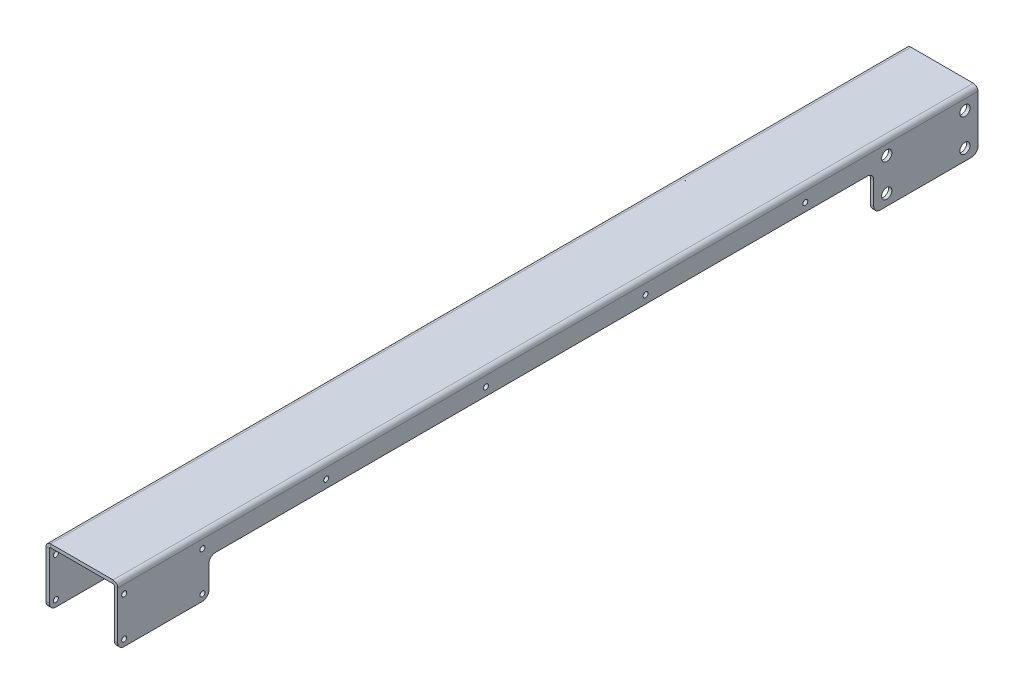
from build123d import *

# Parameters (mm, degrees)
SKETCH1_W                        = 69.85
SKETCH1_H                        = 838.2
BASE_FLANGE1_DEPTH               = 3.2639
EDGE_FLANGE2_STRIP_W             = 15.5956
EDGE_FLANGE2_STRIP_H             = 3.2639
EDGE_FLANGE2_STRIP_CUT_DEPTH     = 838.2
EDGE_FLANGE2_STRIP_2_W           = 15.5956
EDGE_FLANGE2_STRIP_2_H           = 3.2639
EDGE_FLANGE2_STRIP_CUT_2_DEPTH   = 838.2
EDGE_FLANGE2_DEPTH               = 838.2
EDGE_FLANGE2_BEND_DEPTH          = 838.2
SKETCH23_W                       = 101.6
SKETCH23_H                       = 34.925
BOSS_EXTRUDE1_DEPTH              = 3.2639
SKETCH24_W                       = 101.6
SKETCH24_H                       = 34.925
BOSS_EXTRUDE2_DEPTH              = 3.2639
SKETCH32_W                       = 88.9
SKETCH32_H                       = 34.925
BOSS_EXTRUDE3_DEPTH              = 3.2639
BOSS_EXTRUDE4_START              = -3.2639
SKETCH33_W                       = 88.9
SKETCH33_H                       = 34.925
BOSS_EXTRUDE4_DEPTH              = 3.2639
F_10_0_1935_DIAMETER_HOLE2_D     = 4.9149
LPATTERN2_COUNT                  = 4
LPATTERN2_PITCH                  = 155.575
F_25_64_0_39063_DIAMETER_HOLE1_D = 9.922002
F_10_0_1935_DIAMETER_HOLE3_D     = 4.9149
FILLET2_R                        = 6.35


# Sheet-metal steps are written as plain solids
with BuildPart() as part:
    # Sketch1 → Base-Flange1 (new body)
    with BuildSketch(Plane(origin=(0, 0, 0), x_dir=(1, 0, 0), z_dir=(0, 1, 0))):
        with Locations((0, 419.1)):
            Rectangle(SKETCH1_W, SKETCH1_H)
    extrude(amount=-BASE_FLANGE1_DEPTH)

    # Edge-Flange2 strip (across the edge) → Edge-Flange2 strip cut (cut)
    with BuildSketch(Plane(origin=(34.925, -3.2639, -838.2), x_dir=(-1, 0, 0), z_dir=(0, 0, 1))):
        with Locations((-3.2639, -1.63195)):
            Rectangle(EDGE_FLANGE2_STRIP_W, EDGE_FLANGE2_STRIP_H)
    extrude(amount=EDGE_FLANGE2_STRIP_CUT_DEPTH, mode=Mode.SUBTRACT)

    # Edge-Flange2 strip 2 (across the edge) → Edge-Flange2 strip cut 2 (cut)
    with BuildSketch(Plane(origin=(-34.925, -3.2639, 0), x_dir=(1, 0, 0), z_dir=(0, 0, -1))):
        with Locations((-3.2639, -1.63195)):
            Rectangle(EDGE_FLANGE2_STRIP_2_W, EDGE_FLANGE2_STRIP_2_H)
    extrude(amount=EDGE_FLANGE2_STRIP_CUT_2_DEPTH, mode=Mode.SUBTRACT)

    # Edge-Flange2 section (across the edge) → Edge-Flange2 (add)
    with BuildSketch(Plane(origin=(34.925, -3.2639, -838.2), x_dir=(-1, 0, 0), z_dir=(0, 0, 1))):
        with BuildLine():
            Line((0, 1.27), (0, 18.9611))
            Line((0, 18.9611), (3.2639, 18.9611))
            Line((3.2639, 18.9611), (3.2639, 1.27))
            ThreePointArc((3.2639, 1.27), (3.635874388, 0.371974388), (4.5339, 0))
            Line((4.5339, 0), (4.5339, -3.2639))
            ThreePointArc((4.5339, -3.2639), (1.327948565, -1.935951435), (0, 1.27))
        make_face()
    extrude(amount=EDGE_FLANGE2_DEPTH)

    # Edge-Flange2 section 2 (across the edge) → Edge-Flange2 bend (add)
    with BuildSketch(Plane(origin=(-34.925, -3.2639, 0), x_dir=(1, 0, 0), z_dir=(0, 0, -1))):
        with BuildLine():
            Line((0, 1.27), (0, 18.9611))
            Line((0, 18.9611), (3.2639, 18.9611))
            Line((3.2639, 18.9611), (3.2639, 1.27))
            ThreePointArc((3.2639, 1.27), (3.635874388, 0.371974388), (4.5339, 0))
            Line((4.5339, 0), (4.5339, -3.2639))
            ThreePointArc((4.5339, -3.2639), (1.327948565, -1.935951435), (0, 1.27))
        make_face()
    extrude(amount=EDGE_FLANGE2_BEND_DEPTH)

    # Sketch23 → Boss-Extrude1 (add)
    with BuildSketch(Plane.ZY.offset(34.925)):
        with Locations((-787.4, -39.6875)):
            Rectangle(SKETCH23_W, SKETCH23_H)
    extrude(amount=-BOSS_EXTRUDE1_DEPTH)

    # Sketch24 → Boss-Extrude2 (add)
    with BuildSketch(Plane(origin=(34.925, 0, 0), x_dir=(0, 0, -1), z_dir=(1, 0, 0))):
        with Locations((787.4, -39.6875)):
            Rectangle(SKETCH24_W, SKETCH24_H)
    extrude(amount=-BOSS_EXTRUDE2_DEPTH)

    # Sketch32 → Boss-Extrude3 (add)
    with BuildSketch(Plane.ZY.offset(34.925)):
        with Locations((-44.45, -39.6875)):
            Rectangle(SKETCH32_W, SKETCH32_H)
    extrude(amount=-BOSS_EXTRUDE3_DEPTH)

    # Sketch33 → Boss-Extrude4 (add)
    with BuildSketch(Plane(origin=(34.925, 0, 0), x_dir=(0, 0, -1), z_dir=(1, 0, 0)).offset(BOSS_EXTRUDE4_START)):
        with Locations((44.45, -39.6875)):
            Rectangle(SKETCH33_W, SKETCH33_H)
    extrude(amount=BOSS_EXTRUDE4_DEPTH)

    # #10 (0.1935) Diameter Hole2 (through all)
    with Locations(Plane.ZY.offset(34.925)):
        with Locations((-203.2, -14.2875)):
            f_10_0_1935_diameter_hole2 = Hole(F_10_0_1935_DIAMETER_HOLE2_D / 2)

    # LPattern2: #10 (0.1935) Diameter Hole2 ×4
    with Locations(*[(0, 0, -i * LPATTERN2_PITCH) for i in range(1, LPATTERN2_COUNT)]):
        add(f_10_0_1935_diameter_hole2, mode=Mode.SUBTRACT)

    # 25/64 (0.39063) Diameter Hole1 (through all)
    with Locations(Plane.ZY.offset(34.925)):
        with Locations((-825.5, -14.442948), (-825.5, -46.192948), (-749.3, -14.442948), (-749.3, -46.192948)):
            Hole(F_25_64_0_39063_DIAMETER_HOLE1_D / 2)

    # #10 (0.1935) Diameter Hole3 (through all)
    with Locations(Plane.ZY.offset(34.925)):
        with Locations((-82.55, -12.7), (-82.55, -50.8), (-6.35, -12.7), (-6.35, -50.8)):
            Hole(F_10_0_1935_DIAMETER_HOLE3_D / 2)

    # Fillet2
    fillet2_edges = [part.edges().sort_by_distance(p)[0] for p in [
        (-33.29305, -22.225, -88.9),
        (-33.29305, -57.15, -88.9),
        (-33.29305, -57.15, 0),
        (33.29305, -57.15, 0),
        (33.29305, -22.225, -88.9),
        (33.29305, -57.15, -88.9),
        (-33.29305, -57.15, -736.6),
        (-33.29305, -22.225, -736.6),
        (-33.29305, -57.15, -838.2),
        (33.29305, -57.15, -838.2),
        (33.29305, -57.15, -736.6),
        (33.29305, -22.225, -736.6),
    ]]
    fillet(fillet2_edges, radius=FILLET2_R)


solid = part.part
